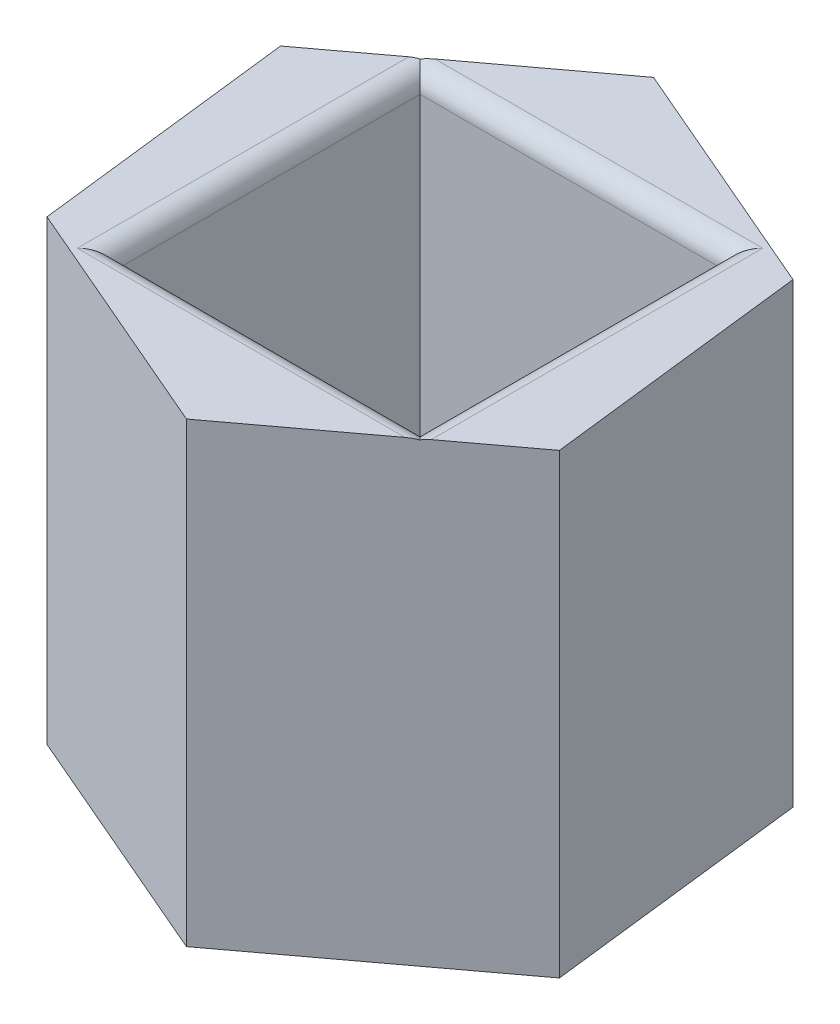
from build123d import *

# Parameters (mm, degrees)
BOSS_EXTRUDE1_DEPTH = 6
SKETCH2_W           = 4
SKETCH2_H           = 4
CUT_EXTRUDE1_DEPTH  = 5
FILLET1_R           = 0.25


with BuildPart() as part:
    # Sketch1 → Boss-Extrude1 (new body)
    with BuildSketch(Plane(origin=(0, 0, 0), x_dir=(1, 0, 0), z_dir=(0, 1, 0))):
        Polygon((3.214834695, -1.383776673), (2.8058031, 2.092240179), (-0.409031596, 3.476016852), (-3.214834695, 1.383776673), (-2.8058031, -2.092240179), (0.409031596, -3.476016852), align=None)
    extrude(amount=BOSS_EXTRUDE1_DEPTH)

    # Sketch2 → Cut-Extrude1 (cut)
    with BuildSketch(Plane(origin=(0, 6, 0), x_dir=(1, 0, 0), z_dir=(0, 1, 0))):
        Rectangle(SKETCH2_W, SKETCH2_H)
    extrude(amount=-CUT_EXTRUDE1_DEPTH, mode=Mode.SUBTRACT)

    # Fillet1
    # the kernel refuses this fillet: 0.25 mm, written as the material it takes off along each edge
    with BuildSketch(Plane(origin=(-2, 6, -2), x_dir=(-1, 0, 0), z_dir=(0, 0, 1)), Plane(origin=(2, 6, -2), x_dir=(0, 0, -1), z_dir=(-1, 0, 0)), Plane(origin=(-2, 6, 2), x_dir=(0, 0, 1), z_dir=(1, 0, 0)), Plane(origin=(2, 6, 2), x_dir=(1, 0, 0), z_dir=(0, 0, -1))) as fillet1_piece_1:
        with BuildLine():
            CenterArc((FILLET1_R, FILLET1_R), FILLET1_R, 180, 90)
            Line((0, FILLET1_R), (-FILLET1_R * 0.02, FILLET1_R))
            Line((-FILLET1_R * 0.02, FILLET1_R), (-FILLET1_R * 0.02, -FILLET1_R * 0.02))
            Line((-FILLET1_R * 0.02, -FILLET1_R * 0.02), (FILLET1_R, -FILLET1_R * 0.02))
            Line((FILLET1_R, -FILLET1_R * 0.02), (FILLET1_R, 0))
        make_face()
    extrude(amount=4, mode=Mode.SUBTRACT)
    with BuildSketch(Plane(origin=(2, 6, -2), x_dir=(0, 0, -1), z_dir=(-1, 0, 0))) as fillet1_piece_2a_section:
        with BuildLine():
            CenterArc((FILLET1_R, FILLET1_R), FILLET1_R, 180, 90)
            Line((0, FILLET1_R), (-FILLET1_R * 0.02, FILLET1_R))
            Line((-FILLET1_R * 0.02, FILLET1_R), (-FILLET1_R * 0.02, -FILLET1_R * 0.02))
            Line((-FILLET1_R * 0.02, -FILLET1_R * 0.02), (FILLET1_R, -FILLET1_R * 0.02))
            Line((FILLET1_R, -FILLET1_R * 0.02), (FILLET1_R, 0))
        make_face()
    fillet1_piece_2a = extrude(amount=4.625, mode=Mode.PRIVATE)
    fillet1_piece_2a = split(fillet1_piece_2a, bisect_by=Plane(origin=(-2, 5.943401221, -2.056598779), z_dir=(-1, 0, 0)), keep=Keep.TOP, mode=Mode.PRIVATE)
    with BuildSketch(Plane(origin=(-2, 6, -2.625), x_dir=(-1, 0, 0), z_dir=(0, 0, 1))) as fillet1_piece_2b_section:
        with BuildLine():
            CenterArc((FILLET1_R, FILLET1_R), FILLET1_R, 180, 90)
            Line((0, FILLET1_R), (-FILLET1_R * 0.02, FILLET1_R))
            Line((-FILLET1_R * 0.02, FILLET1_R), (-FILLET1_R * 0.02, -FILLET1_R * 0.02))
            Line((-FILLET1_R * 0.02, -FILLET1_R * 0.02), (FILLET1_R, -FILLET1_R * 0.02))
            Line((FILLET1_R, -FILLET1_R * 0.02), (FILLET1_R, 0))
        make_face()
    fillet1_piece_2b = extrude(amount=4.625, mode=Mode.PRIVATE)
    fillet1_piece_2b = split(fillet1_piece_2b, bisect_by=Plane(origin=(-2.056598779, 5.943401221, -2), z_dir=(0, 0, -1)), keep=Keep.TOP, mode=Mode.PRIVATE)
    fillet1_piece_2 = fillet1_piece_2a & fillet1_piece_2b
    add(fillet1_piece_2, mode=Mode.SUBTRACT)
    with BuildSketch(Plane(origin=(-2.625, 6, 2), x_dir=(0, 0, 1), z_dir=(1, 0, 0))) as fillet1_piece_3a_section:
        with BuildLine():
            CenterArc((FILLET1_R, FILLET1_R), FILLET1_R, 180, 90)
            Line((0, FILLET1_R), (-FILLET1_R * 0.02, FILLET1_R))
            Line((-FILLET1_R * 0.02, FILLET1_R), (-FILLET1_R * 0.02, -FILLET1_R * 0.02))
            Line((-FILLET1_R * 0.02, -FILLET1_R * 0.02), (FILLET1_R, -FILLET1_R * 0.02))
            Line((FILLET1_R, -FILLET1_R * 0.02), (FILLET1_R, 0))
        make_face()
    fillet1_piece_3a = extrude(amount=4.625, mode=Mode.PRIVATE)
    fillet1_piece_3a = split(fillet1_piece_3a, bisect_by=Plane(origin=(-2, 5.943401221, 2.056598779), z_dir=(-1, 0, 0)), keep=Keep.TOP, mode=Mode.PRIVATE)
    with BuildSketch(Plane(origin=(-2, 6, -2), x_dir=(-1, 0, 0), z_dir=(0, 0, 1))) as fillet1_piece_3b_section:
        with BuildLine():
            CenterArc((FILLET1_R, FILLET1_R), FILLET1_R, 180, 90)
            Line((0, FILLET1_R), (-FILLET1_R * 0.02, FILLET1_R))
            Line((-FILLET1_R * 0.02, FILLET1_R), (-FILLET1_R * 0.02, -FILLET1_R * 0.02))
            Line((-FILLET1_R * 0.02, -FILLET1_R * 0.02), (FILLET1_R, -FILLET1_R * 0.02))
            Line((FILLET1_R, -FILLET1_R * 0.02), (FILLET1_R, 0))
        make_face()
    fillet1_piece_3b = extrude(amount=4.625, mode=Mode.PRIVATE)
    fillet1_piece_3b = split(fillet1_piece_3b, bisect_by=Plane(origin=(-2.056598779, 5.943401221, 2), z_dir=(0, 0, 1)), keep=Keep.TOP, mode=Mode.PRIVATE)
    fillet1_piece_3 = fillet1_piece_3a & fillet1_piece_3b
    add(fillet1_piece_3, mode=Mode.SUBTRACT)
    with BuildSketch(Plane(origin=(2, 6, 2), x_dir=(1, 0, 0), z_dir=(0, 0, -1))) as fillet1_piece_4a_section:
        with BuildLine():
            CenterArc((FILLET1_R, FILLET1_R), FILLET1_R, 180, 90)
            Line((0, FILLET1_R), (-FILLET1_R * 0.02, FILLET1_R))
            Line((-FILLET1_R * 0.02, FILLET1_R), (-FILLET1_R * 0.02, -FILLET1_R * 0.02))
            Line((-FILLET1_R * 0.02, -FILLET1_R * 0.02), (FILLET1_R, -FILLET1_R * 0.02))
            Line((FILLET1_R, -FILLET1_R * 0.02), (FILLET1_R, 0))
        make_face()
    fillet1_piece_4a = extrude(amount=4.625, mode=Mode.PRIVATE)
    fillet1_piece_4a = split(fillet1_piece_4a, bisect_by=Plane(origin=(2.056598779, 5.943401221, -2), z_dir=(0, 0, -1)), keep=Keep.TOP, mode=Mode.PRIVATE)
    with BuildSketch(Plane(origin=(2.625, 6, -2), x_dir=(0, 0, -1), z_dir=(-1, 0, 0))) as fillet1_piece_4b_section:
        with BuildLine():
            CenterArc((FILLET1_R, FILLET1_R), FILLET1_R, 180, 90)
            Line((0, FILLET1_R), (-FILLET1_R * 0.02, FILLET1_R))
            Line((-FILLET1_R * 0.02, FILLET1_R), (-FILLET1_R * 0.02, -FILLET1_R * 0.02))
            Line((-FILLET1_R * 0.02, -FILLET1_R * 0.02), (FILLET1_R, -FILLET1_R * 0.02))
            Line((FILLET1_R, -FILLET1_R * 0.02), (FILLET1_R, 0))
        make_face()
    fillet1_piece_4b = extrude(amount=4.625, mode=Mode.PRIVATE)
    fillet1_piece_4b = split(fillet1_piece_4b, bisect_by=Plane(origin=(2, 5.943401221, -2.056598779), z_dir=(1, 0, 0)), keep=Keep.TOP, mode=Mode.PRIVATE)
    fillet1_piece_4 = fillet1_piece_4a & fillet1_piece_4b
    add(fillet1_piece_4, mode=Mode.SUBTRACT)
    with BuildSketch(Plane(origin=(-2, 6, 2), x_dir=(0, 0, 1), z_dir=(1, 0, 0))) as fillet1_piece_5a_section:
        with BuildLine():
            CenterArc((FILLET1_R, FILLET1_R), FILLET1_R, 180, 90)
            Line((0, FILLET1_R), (-FILLET1_R * 0.02, FILLET1_R))
            Line((-FILLET1_R * 0.02, FILLET1_R), (-FILLET1_R * 0.02, -FILLET1_R * 0.02))
            Line((-FILLET1_R * 0.02, -FILLET1_R * 0.02), (FILLET1_R, -FILLET1_R * 0.02))
            Line((FILLET1_R, -FILLET1_R * 0.02), (FILLET1_R, 0))
        make_face()
    fillet1_piece_5a = extrude(amount=4.625, mode=Mode.PRIVATE)
    fillet1_piece_5a = split(fillet1_piece_5a, bisect_by=Plane(origin=(2, 5.943401221, 2.056598779), z_dir=(1, 0, 0)), keep=Keep.TOP, mode=Mode.PRIVATE)
    with BuildSketch(Plane(origin=(2, 6, 2.625), x_dir=(1, 0, 0), z_dir=(0, 0, -1))) as fillet1_piece_5b_section:
        with BuildLine():
            CenterArc((FILLET1_R, FILLET1_R), FILLET1_R, 180, 90)
            Line((0, FILLET1_R), (-FILLET1_R * 0.02, FILLET1_R))
            Line((-FILLET1_R * 0.02, FILLET1_R), (-FILLET1_R * 0.02, -FILLET1_R * 0.02))
            Line((-FILLET1_R * 0.02, -FILLET1_R * 0.02), (FILLET1_R, -FILLET1_R * 0.02))
            Line((FILLET1_R, -FILLET1_R * 0.02), (FILLET1_R, 0))
        make_face()
    fillet1_piece_5b = extrude(amount=4.625, mode=Mode.PRIVATE)
    fillet1_piece_5b = split(fillet1_piece_5b, bisect_by=Plane(origin=(2.056598779, 5.943401221, 2), z_dir=(0, 0, 1)), keep=Keep.TOP, mode=Mode.PRIVATE)
    fillet1_piece_5 = fillet1_piece_5a & fillet1_piece_5b
    add(fillet1_piece_5, mode=Mode.SUBTRACT)


solid = part.part
